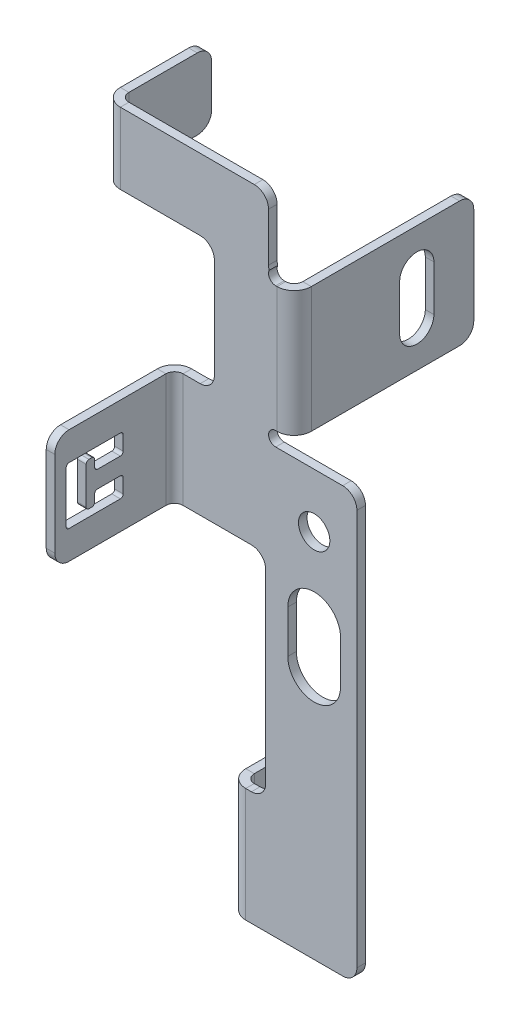
from build123d import *

# Parameters (mm, degrees)
BASE_FLANGE1_DEPTH           = 3
SKETCH6_R                    = 5.5
CUT_EXTRUDE1_DEPTH           = 10
EDGE_FLANGE2_START           = -6.5
EDGE_FLANGE2_OUTLINE_W       = 5
EDGE_FLANGE2_OUTLINE_H       = 3
EDGE_FLANGE2_DEPTH           = 6.5
EDGE_FLANGE2_START_2         = -0.63372
EDGE_FLANGE2_2_OUTLINE_W     = 44
EDGE_FLANGE2_2_OUTLINE_H     = 3
EDGE_FLANGE2_2_DEPTH         = 0.63372
EDGE_FLANGE2_START_3         = -3
EDGE_FLANGE2_3_OUTLINE_W     = 44
EDGE_FLANGE2_3_OUTLINE_H     = 60
EDGE_FLANGE2_3_DEPTH         = 2.36628
EDGE_FLANGE2_4_DEPTH         = 3
EDGE_FLANGE2_START_4         = -34
EDGE_FLANGE2_5_OUTLINE_W     = 0.63372
EDGE_FLANGE2_5_OUTLINE_H     = 44
EDGE_FLANGE2_5_DEPTH         = 31
EDGE_FLANGE2_START_5         = -60
EDGE_FLANGE2_6_OUTLINE_W     = 0.63372
EDGE_FLANGE2_6_OUTLINE_H     = 44
EDGE_FLANGE2_6_DEPTH         = 14
EDGE_FLANGE2_START_6         = 59
EDGE_FLANGE2_7_DEPTH         = 44
EDGE_FLANGE2_8_OUTLINE_W     = 0.63372
EDGE_FLANGE2_8_OUTLINE_H     = 12
EDGE_FLANGE2_8_DEPTH         = 2.2355
EDGE_FLANGE2_START_7         = -7.63372
EDGE_FLANGE2_9_DEPTH         = 0.63372
EDGE_FLANGE2_10_DEPTH        = 44
EDGE_FLANGE2_START_8         = -7.76405
EDGE_FLANGE2_11_OUTLINE_W    = 44
EDGE_FLANGE2_11_OUTLINE_H    = 3
EDGE_FLANGE2_11_DEPTH        = 0.13033
FILLET1_R                    = 5
EDGE_FLANGE3_STRIP_W         = 18
EDGE_FLANGE3_STRIP_H         = 3
EDGE_FLANGE3_STRIP_CUT_DEPTH = 25
EDGE_FLANGE3_DEPTH           = 25
FILLET2_R                    = 5
EDGE_FLANGE4_STRIP_W         = 18
EDGE_FLANGE4_STRIP_H         = 3
EDGE_FLANGE4_STRIP_CUT_DEPTH = 40
EDGE_FLANGE4_DEPTH           = 40
EDGE_FLANGE4_PROFILE_W       = 40
EDGE_FLANGE4_PROFILE_H       = 39
EDGE_FLANGE4_FLAT_DEPTH      = 3
FILLET3_R                    = 1
FILLET4_R                    = 5
EDGE_FLANGE5_STRIP_W         = 18
EDGE_FLANGE5_STRIP_H         = 3
EDGE_FLANGE5_STRIP_CUT_DEPTH = 40
EDGE_FLANGE5_DEPTH           = 40
EDGE_FLANGE5_PROFILE_W       = 40
EDGE_FLANGE5_PROFILE_H       = 38
EDGE_FLANGE5_FLAT_DEPTH      = 3
FILLET5_R                    = 1
FILLET6_R                    = 5


with BuildPart() as part:
    # Base-Flange1: sheet metal written as solids
    # Sketch1 → Base-Flange1 (new body)
    with BuildSketch(Plane(origin=(0, 0, 0), x_dir=(0, 1, 0), z_dir=(0, 0, 1))):
        with BuildLine():
            Line((-90, -15), (49, -15))
            ThreePointArc((49, -15), (52.535533906, -13.535533906), (54, -10))
            Line((54, -10), (54, 7))
            Line((54, 7), (103, 7))
            Line((103, 7), (103, 11))
            ThreePointArc((103, 11), (104.464466094, 14.535533906), (108, 16))
            Line((108, 16), (125, 16))
            ThreePointArc((125, 16), (128.535533906, 17.464466094), (130, 21))
            Line((130, 21), (130, 74))
            Line((130, 74), (105, 74))
            Line((105, 74), (105, 40))
            ThreePointArc((105, 40), (103.535533906, 36.464466094), (100, 35))
            Line((100, 35), (65, 35))
            ThreePointArc((65, 35), (61.464466094, 36.464466094), (60, 40))
            Line((60, 40), (60, 52))
            Line((60, 52), (20, 52))
            Line((20, 52), (20, 22))
            ThreePointArc((20, 22), (18.535533906, 18.464466094), (15, 17))
            Line((15, 17), (-50, 17))
            ThreePointArc((-50, 17), (-53.535533906, 18.464466094), (-55, 22))
            Line((-55, 22), (-55, 30))
            Line((-55, 30), (-95, 30))
            Line((-95, 30), (-95, -10))
            ThreePointArc((-95, -10), (-93.535533906, -13.535533906), (-90, -15))
        make_face()
    extrude(amount=BASE_FLANGE1_DEPTH)

    # Sketch6 → Cut-Extrude1 (cut)
    with BuildSketch(Plane.XY.offset(3)):
        with Locations((0, 35)):
            Circle(SKETCH6_R)
        with BuildLine():
            Line((9.25, 7.5), (9.25, -7.5))
            ThreePointArc((9.25, -7.5), (0, -16.75), (-9.25, -7.5))
            Line((-9.25, -7.5), (-9.25, 7.5))
            ThreePointArc((-9.25, 7.5), (0, 16.75), (9.25, 7.5))
        make_face()
    extrude(amount=-CUT_EXTRUDE1_DEPTH, mode=Mode.SUBTRACT)

    # Edge-Flange2: read off the stored shape, not the designer's step
    # Edge-Flange2 outline → Edge-Flange2 (cut)
    with BuildSketch(Plane(origin=(-7, 0, 0), x_dir=(0, -1, 0), z_dir=(1, 0, 0)).offset(EDGE_FLANGE2_START)):
        with Locations((-56.5, -1.5)):
            Rectangle(EDGE_FLANGE2_OUTLINE_W, EDGE_FLANGE2_OUTLINE_H)
    extrude(amount=EDGE_FLANGE2_DEPTH, mode=Mode.SUBTRACT)

    # Edge-Flange2 2 outline → Edge-Flange2 2 (cut)
    with BuildSketch(Plane(origin=(-7, 0, 0), x_dir=(0, -1, 0), z_dir=(1, 0, 0)).offset(EDGE_FLANGE2_START_2)):
        with Locations((-81, -1.5)):
            Rectangle(EDGE_FLANGE2_2_OUTLINE_W, EDGE_FLANGE2_2_OUTLINE_H)
    extrude(amount=EDGE_FLANGE2_2_DEPTH, mode=Mode.SUBTRACT)

    # Edge-Flange2 3 outline → Edge-Flange2 3 (add)
    with BuildSketch(Plane(origin=(-7, 0, 0), x_dir=(0, -1, 0), z_dir=(1, 0, 0)).offset(EDGE_FLANGE2_START_3)):
        with Locations((-81, 30)):
            Rectangle(EDGE_FLANGE2_3_OUTLINE_W, EDGE_FLANGE2_3_OUTLINE_H)
        with BuildLine():
            Line((-73, 34), (-89, 34))
            ThreePointArc((-89, 34), (-95, 40), (-89, 46))
            Line((-89, 46), (-73, 46))
            ThreePointArc((-73, 46), (-67, 40), (-73, 34))
        make_face(mode=Mode.SUBTRACT)
    extrude(amount=EDGE_FLANGE2_3_DEPTH)

    # Edge-Flange2 4 outline → Edge-Flange2 4 (cut)
    with BuildSketch(Plane.XY):
        with BuildLine():
            Line((-13.5, 54), (-13.5, 59))
            ThreePointArc((-13.5, 59), (-16, 56.5), (-13.5, 54))
        make_face()
        with BuildLine():
            Line((-13.5, 103), (-11, 103))
            ThreePointArc((-11, 103), (-13.970098723, 103.977747698), (-15.778594569, 106.528594569))
            ThreePointArc((-15.778594569, 106.528594569), (-15.600176948, 104.143807982), (-13.5, 103))
        make_face()
    extrude(amount=EDGE_FLANGE2_4_DEPTH, mode=Mode.SUBTRACT)

    # Edge-Flange2 5 outline → Edge-Flange2 5 (add)
    with BuildSketch(Plane.XY.offset(EDGE_FLANGE2_START_4)):
        with Locations((-7.31686, 81)):
            Rectangle(EDGE_FLANGE2_5_OUTLINE_W, EDGE_FLANGE2_5_OUTLINE_H)
    extrude(amount=EDGE_FLANGE2_5_DEPTH)

    # Edge-Flange2 6 outline → Edge-Flange2 6 (add)
    with BuildSketch(Plane.XY.offset(EDGE_FLANGE2_START_5)):
        with Locations((-7.31686, 81)):
            Rectangle(EDGE_FLANGE2_6_OUTLINE_W, EDGE_FLANGE2_6_OUTLINE_H)
    extrude(amount=EDGE_FLANGE2_6_DEPTH)

    # Edge-Flange2 7 outline → Edge-Flange2 7 (add)
    with BuildSketch(Plane(origin=(0, 0, 0), x_dir=(1, 0, 0), z_dir=(0, 1, 0)).offset(EDGE_FLANGE2_START_6)):
        with BuildLine():
            ThreePointArc((-7.63372, 0.31615221), (-7.160578796, 1.621174413), (-7, 3))
            Line((-7, 3), (-7.63372, 3))
            Line((-7.63372, 3), (-7.63372, 0.31615221))
        make_face()
        with BuildLine():
            Line((-13, 0), (-10, 0))
            Line((-10, 0), (-10, 3))
            ThreePointArc((-10, 3), (-10.878679656, 0.878679656), (-13, 0))
        make_face()
    extrude(amount=EDGE_FLANGE2_7_DEPTH)

    # Edge-Flange2 8 outline → Edge-Flange2 8 (add)
    with BuildSketch(Plane(origin=(0, 0, 0), x_dir=(1, 0, 0), z_dir=(0, 1, 0)).offset(EDGE_FLANGE2_START_6)):
        with Locations((-7.31686, 40)):
            Rectangle(EDGE_FLANGE2_8_OUTLINE_W, EDGE_FLANGE2_8_OUTLINE_H)
    extrude(amount=EDGE_FLANGE2_8_DEPTH)

    # Edge-Flange2 9 outline → Edge-Flange2 9 (add)
    with BuildSketch(Plane.YZ.offset(EDGE_FLANGE2_START_7)):
        with BuildLine():
            Line((103, -46), (103, -34))
            Line((103, -34), (89, -34))
            ThreePointArc((89, -34), (95, -40), (89, -46))
            Line((89, -46), (103, -46))
        make_face()
        with BuildLine():
            Line((73, -34), (59, -34))
            Line((59, -34), (59, -46))
            Line((59, -46), (73, -46))
            ThreePointArc((73, -46), (67, -40), (73, -34))
        make_face()
    extrude(amount=EDGE_FLANGE2_9_DEPTH)

    # Edge-Flange2 10 outline → Edge-Flange2 10 (cut)
    with BuildSketch(Plane(origin=(0, 0, 0), x_dir=(1, 0, 0), z_dir=(0, 1, 0)).offset(EDGE_FLANGE2_START_6)):
        with BuildLine():
            ThreePointArc((-7.63372, 0.31615221), (-9.845882591, -2.104071254), (-13, -3))
            Line((-13, -3), (-7.63372, -3))
            Line((-7.63372, -3), (-7.63372, 0.31615221))
        make_face()
    extrude(amount=EDGE_FLANGE2_10_DEPTH, mode=Mode.SUBTRACT)

    # Edge-Flange2 11 outline → Edge-Flange2 11 (cut)
    with BuildSketch(Plane.YZ.offset(EDGE_FLANGE2_START_8)):
        with Locations((81, 1.5)):
            Rectangle(EDGE_FLANGE2_11_OUTLINE_W, EDGE_FLANGE2_11_OUTLINE_H)
    extrude(amount=EDGE_FLANGE2_11_DEPTH, mode=Mode.SUBTRACT)

    # Fillet1
    fillet1_edges = [part.edges().sort_by_distance(p)[0] for p in [
        (-8.5, 103, -60),
        (-8.5, 59, -60),
    ]]
    fillet(fillet1_edges, radius=FILLET1_R)

    # Edge-Flange3: sheet metal written as solids
    # Edge-Flange3 strip (on a plane across the edge) → Edge-Flange3 strip cut (cut)
    with BuildSketch(Plane(origin=(-74, 105, 0), x_dir=(1, 0, 0), z_dir=(0, 1, 0))):
        with Locations((-3, -1.5)):
            Rectangle(EDGE_FLANGE3_STRIP_W, EDGE_FLANGE3_STRIP_H)
    extrude(amount=EDGE_FLANGE3_STRIP_CUT_DEPTH, mode=Mode.SUBTRACT)

    # Edge-Flange3 section (on a plane across the edge) → Edge-Flange3 (add)
    with BuildSketch(Plane(origin=(-74, 105, 0), x_dir=(1, 0, 0), z_dir=(0, 1, 0))):
        with BuildLine():
            Line((0, 3), (0, 32))
            Line((0, 32), (3, 32))
            Line((3, 32), (3, 3))
            ThreePointArc((3, 3), (3.878679656, 0.878679656), (6, 0))
            Line((6, 0), (6, -3))
            ThreePointArc((6, -3), (1.757359313, -1.242640687), (0, 3))
        make_face()
    extrude(amount=EDGE_FLANGE3_DEPTH)

    # Fillet2
    fillet2_edges = [part.edges().sort_by_distance(p)[0] for p in [
        (-72.5, 105, -32),
        (-72.5, 130, -32),
    ]]
    fillet(fillet2_edges, radius=FILLET2_R)

    # Edge-Flange4: sheet metal written as solids
    # Edge-Flange4 strip (on a plane across the edge) → Edge-Flange4 strip cut (cut)
    with BuildSketch(Plane(origin=(-52, 60, 3), x_dir=(1, 0, 0), z_dir=(0, -1, 0))):
        with Locations((-3, -1.5)):
            Rectangle(EDGE_FLANGE4_STRIP_W, EDGE_FLANGE4_STRIP_H)
    extrude(amount=EDGE_FLANGE4_STRIP_CUT_DEPTH, mode=Mode.SUBTRACT)

    # Edge-Flange4 bend section (on a plane across the edge) → Edge-Flange4 (add)
    with BuildSketch(Plane(origin=(-52, 60, 3), x_dir=(1, 0, 0), z_dir=(0, -1, 0))):
        with BuildLine():
            Line((0, 3), (3, 3))
            ThreePointArc((3, 3), (3.878679656, 0.878679656), (6, 0))
            Line((6, 0), (6, -3))
            ThreePointArc((6, -3), (1.757359313, -1.242640687), (0, 3))
        make_face()
    extrude(amount=EDGE_FLANGE4_DEPTH)

    # Edge-Flange4 profile (on flange) → Edge-Flange4 flat (add)
    with BuildSketch(Plane(origin=(-52, 0, 3), x_dir=(0, -1, 0), z_dir=(-1, 0, 0))):
        with Locations((-40, 22.5)):
            Rectangle(EDGE_FLANGE4_PROFILE_W, EDGE_FLANGE4_PROFILE_H)
        with BuildLine():
            Line((-30, 38), (-30, 19))
            ThreePointArc((-30, 19), (-30.292893219, 18.292893219), (-31, 18))
            Line((-31, 18), (-36, 18))
            ThreePointArc((-36, 18), (-36.707106781, 18.292893219), (-37, 19))
            Line((-37, 19), (-37, 27))
            ThreePointArc((-37, 27), (-36.707106781, 27.707106781), (-36, 28))
            Line((-36, 28), (-33.5, 28))
            ThreePointArc((-33.5, 28), (-32.792893219, 28.292893219), (-32.5, 29))
            Line((-32.5, 29), (-32.5, 31))
            Line((-32.5, 31), (-47.5, 31))
            Line((-47.5, 31), (-47.5, 29))
            ThreePointArc((-47.5, 29), (-47.207106781, 28.292893219), (-46.5, 28))
            Line((-46.5, 28), (-44, 28))
            ThreePointArc((-44, 28), (-43.292893219, 27.707106781), (-43, 27))
            Line((-43, 27), (-43, 19))
            ThreePointArc((-43, 19), (-43.292893219, 18.292893219), (-44, 18))
            Line((-44, 18), (-49, 18))
            ThreePointArc((-49, 18), (-49.707106781, 18.292893219), (-50, 19))
            Line((-50, 19), (-50, 38))
            Line((-50, 38), (-30, 38))
        make_face(mode=Mode.SUBTRACT)
    extrude(amount=-EDGE_FLANGE4_FLAT_DEPTH)

    # Fillet3
    fillet3_edges = [part.edges().sort_by_distance(p)[0] for p in [
        (-50.5, 30, 41),
        (-50.5, 50, 41),
        (-50.5, 47.5, 34),
        (-50.5, 32.5, 34),
    ]]
    fillet(fillet3_edges, radius=FILLET3_R)

    # Fillet4
    fillet4_edges = [part.edges().sort_by_distance(p)[0] for p in [
        (-50.5, 60, 45),
        (-50.5, 20, 45),
    ]]
    fillet(fillet4_edges, radius=FILLET4_R)

    # Edge-Flange5: sheet metal written as solids
    # Edge-Flange5 strip (on a plane across the edge) → Edge-Flange5 strip cut (cut)
    with BuildSketch(Plane(origin=(-30, -95, 0), x_dir=(1, 0, 0), z_dir=(0, 1, 0))):
        with Locations((-3, -1.5)):
            Rectangle(EDGE_FLANGE5_STRIP_W, EDGE_FLANGE5_STRIP_H)
    extrude(amount=EDGE_FLANGE5_STRIP_CUT_DEPTH, mode=Mode.SUBTRACT)

    # Edge-Flange5 bend section (on a plane across the edge) → Edge-Flange5 (add)
    with BuildSketch(Plane(origin=(-30, -95, 0), x_dir=(1, 0, 0), z_dir=(0, 1, 0))):
        with BuildLine():
            Line((0, 3), (3, 3))
            ThreePointArc((3, 3), (3.878679656, 0.878679656), (6, 0))
            Line((6, 0), (6, -3))
            ThreePointArc((6, -3), (1.757359313, -1.242640687), (0, 3))
        make_face()
    extrude(amount=EDGE_FLANGE5_DEPTH)

    # Edge-Flange5 profile (on flange) → Edge-Flange5 flat (add)
    with BuildSketch(Plane(origin=(-30, 0, 0), x_dir=(0, 1, 0), z_dir=(-1, 0, 0))):
        with Locations((-75, 22)):
            Rectangle(EDGE_FLANGE5_PROFILE_W, EDGE_FLANGE5_PROFILE_H)
        with BuildLine():
            ThreePointArc((-88, 33), (-87.707106781, 33.707106781), (-87, 34))
            Line((-87, 34), (-68, 34))
            Line((-68, 34), (-68, 13))
            Line((-68, 13), (-87, 13))
            ThreePointArc((-87, 13), (-87.707106781, 13.292893219), (-88, 14))
            Line((-88, 14), (-88, 19))
            ThreePointArc((-88, 19), (-87.707106781, 19.707106781), (-87, 20))
            Line((-87, 20), (-79, 20))
            ThreePointArc((-79, 20), (-78.292893219, 19.707106781), (-78, 19))
            Line((-78, 19), (-78, 16))
            ThreePointArc((-78, 16), (-77.707106781, 15.292893219), (-77, 15))
            Line((-77, 15), (-75, 15))
            Line((-75, 15), (-75, 32))
            Line((-75, 32), (-77, 32))
            ThreePointArc((-77, 32), (-77.707106781, 31.707106781), (-78, 31))
            Line((-78, 31), (-78, 28))
            ThreePointArc((-78, 28), (-78.292893219, 27.292893219), (-79, 27))
            Line((-79, 27), (-87, 27))
            ThreePointArc((-87, 27), (-87.707106781, 27.292893219), (-88, 28))
            Line((-88, 28), (-88, 33))
        make_face(mode=Mode.SUBTRACT)
    extrude(amount=-EDGE_FLANGE5_FLAT_DEPTH)

    # Fillet5
    fillet5_edges = [part.edges().sort_by_distance(p)[0] for p in [
        (-28.5, -68, -13),
        (-28.5, -68, -34),
        (-28.5, -75, -32),
        (-28.5, -75, -15),
    ]]
    fillet(fillet5_edges, radius=FILLET5_R)

    # Fillet6
    fillet6_edges = [part.edges().sort_by_distance(p)[0] for p in [
        (-28.5, -95, -41),
        (-28.5, -55, -41),
    ]]
    fillet(fillet6_edges, radius=FILLET6_R)


solid = part.part
